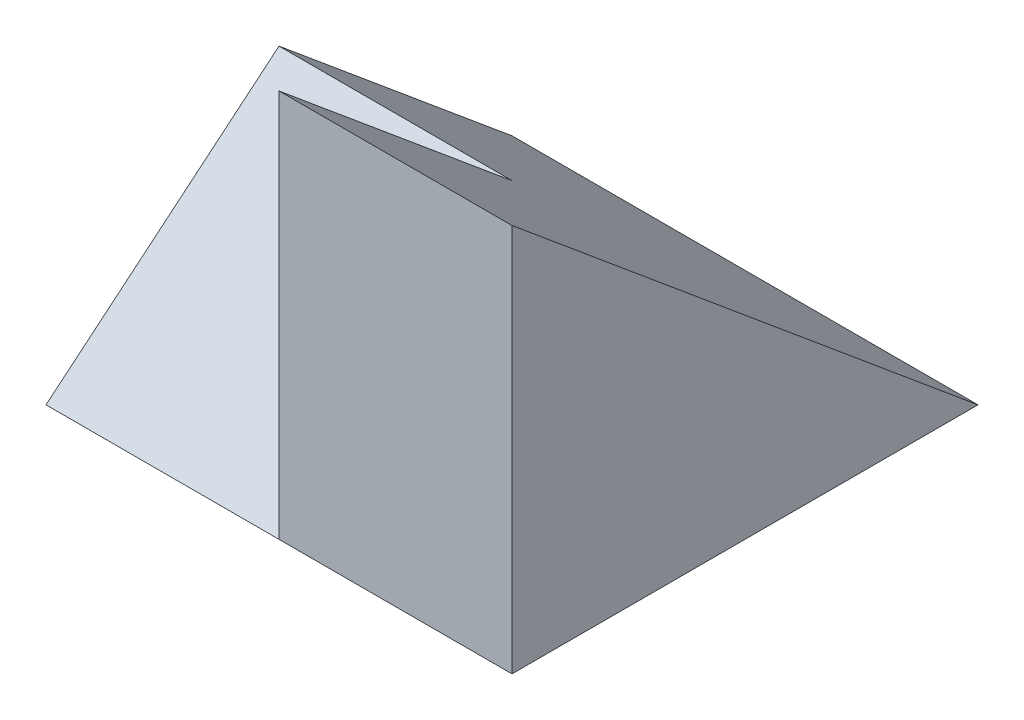
from build123d import *

# Parameters (mm, degrees)
SKETCH1_W           = 6
SKETCH1_H           = 6
BOSS_EXTRUDE1_DEPTH = 5
CUT_EXTRUDE9_DEPTH  = 23.5
CUT_EXTRUDE10_DEPTH = 3


with BuildPart() as part:
    # Sketch1 → Boss-Extrude1 (new body)
    with BuildSketch(Plane(origin=(0, 0, 0), x_dir=(1, 0, 0), z_dir=(0, 1, 0))):
        Rectangle(SKETCH1_W, SKETCH1_H)
    extrude(amount=BOSS_EXTRUDE1_DEPTH)

    # Sketch12 → Cut-Extrude9 (cut)
    with BuildSketch(Plane.ZY.offset(3)):
        Polygon((-3, 5), (-3, 0), (3, 5), align=None)
    extrude(amount=-CUT_EXTRUDE9_DEPTH, mode=Mode.SUBTRACT)

    # Sketch13 → Cut-Extrude10 (cut)
    with BuildSketch(Plane.ZY.offset(3)):
        Polygon((3, 5), (0, 2.5), (3, 0), align=None)
    extrude(amount=-CUT_EXTRUDE10_DEPTH, mode=Mode.SUBTRACT)


solid = part.part
